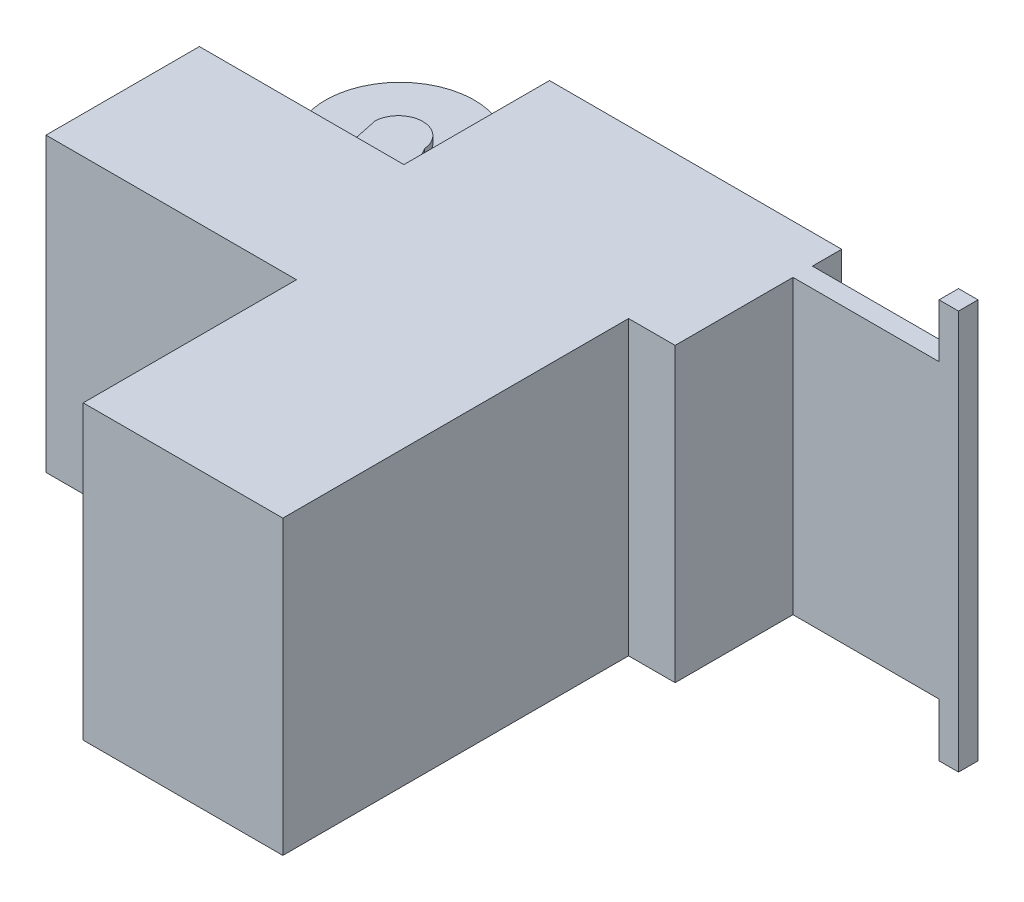
from build123d import *

# Parameters (mm, degrees)
SKETCH_1_W                     = 300
SKETCH_1_H                     = 171
EXTRUDE_1_DEPTH                = 300
SKETCH_2_W                     = 205.00000064
SKETCH_2_H                     = 300
EXTRUDE_2_DEPTH                = 355
SKETCH_3_W                     = 300
SKETCH_3_H                     = 136
EXTRUDE_3_DEPTH                = 257.21007636
EXTRUDE_4_DEPTH                = 24
EXTRUDE_5_DEPTH                = 120
EXTRUDE_7_DEPTH                = 62
CUT_EXTRUDE_3_DEPTH            = 133
EXTRUDE_9_DEPTH                = 62
CUT_EXTRUDE_4_DEPTH            = 7.5
CUT_EXTRUDE_START              = -7.5
CUT_EXTRUDE_5_DEPTH            = 7.5
SKETCH_13_W                    = 300
SKETCH_13_H                    = 20
EXTRUDE_10_DEPTH               = 170
SKETCH_14_W                    = 20
SKETCH_14_H                    = 20
EXTRUDE_11_DEPTH               = 55
SKETCH_15_W                    = 20
SKETCH_15_H                    = 20
EXTRUDE_13_DEPTH               = 55
MOVE_BODY_2_ANGLE              = 90
SPLIT_START                    = -187.136600778
SPLIT_BODIES_1_DEPTH           = 300
SPLIT_START_2                  = -242.136600778
SPLIT_BODIES_1_2_OUTLINE_W     = 20
SPLIT_BODIES_1_2_OUTLINE_H     = 20
SPLIT_BODIES_1_2_DEPTH         = 410
SPLIT_START_3                  = -212.722279175
SPLIT_BODIES_1_3_DEPTH         = 171
SPLIT_START_4                  = -68.136600778
SPLIT_BODIES_1_4_DEPTH         = 62
SPLIT_START_5                  = -97.136600778
SPLIT_BODIES_1_5_OUTLINE_W     = 120
SPLIT_BODIES_1_5_OUTLINE_H     = 24
SPLIT_BODIES_1_5_DEPTH         = 120
SKETCH_16_W                    = 210
SKETCH_16_H                    = 300
EXTRUDE_14_DEPTH               = 21.5
SPLIT_START_6                  = -63.222279175
SPLIT_BODIES_4_OUTLINE_W       = 257.21007636
SPLIT_BODIES_4_OUTLINE_H       = 300
SPLIT_BODIES_4_DEPTH           = 157.5
SPLIT_BODIES_4_2_OUTLINE_W     = 47.21007636
SPLIT_BODIES_4_2_OUTLINE_H     = 300
SPLIT_BODIES_4_2_DEPTH         = 149.5
SPLIT_BODIES_4_3_OUTLINE_W     = 257.21007636
SPLIT_BODIES_4_3_OUTLINE_H     = 300
SPLIT_BODIES_4_3_DEPTH         = 157.5
SPLIT_BODIES_4_4_OUTLINE_W     = 47.21007636
SPLIT_BODIES_4_4_OUTLINE_H     = 300
SPLIT_BODIES_4_4_DEPTH         = 149.5
SPLIT_BODIES_7_SURFACE_1_BACK  = 1003.933
SPLIT_BODIES_7_SURFACE_1_DEPTH = 2007.866
SPLIT_BODIES_7_SURFACE_2_BACK  = 1003.933
SPLIT_BODIES_7_SURFACE_2_DEPTH = 2007.866


# Read off the part's stored shape, not the designer's step: 部品分割1, 部品分割3, 部品分割4
with BuildPart() as part:
    # ｽｹｯﾁ1 → ﾎﾞｽ - 押し出し1 (new body)
    with BuildSketch(Plane(origin=(0, 0, 0), x_dir=(0, 0, -1), z_dir=(1, 0, 0))):
        with Locations((105.647745135, 53.288865182)):
            Rectangle(SKETCH_1_W, SKETCH_1_H)
    extrude(amount=EXTRUDE_1_DEPTH)

    # ｽｹｯﾁ2 → ﾎﾞｽ - 押し出し2 (add)
    with BuildSketch(Plane(origin=(0, 138.788865182, 0), x_dir=(1, 0, 0), z_dir=(0, 1, 0))):
        with Locations((149.71007668, 105.647745135)):
            Rectangle(SKETCH_2_W, SKETCH_2_H)
    extrude(amount=EXTRUDE_2_DEPTH)

    # ｽｹｯﾁ3 → ﾎﾞｽ - 押し出し3 (add)
    with BuildSketch(Plane.ZY.offset(-47.21007636)):
        with Locations((-105.647745135, 206.788865182)):
            Rectangle(SKETCH_3_W, SKETCH_3_H)
    extrude(amount=EXTRUDE_3_DEPTH)

    # ｽｹｯﾁ4 → ﾎﾞｽ - 押し出し4 (add)
    with BuildSketch(Plane.XZ.offset(-138.788865182)):
        Polygon((-141.96039145, -105.647745135), (-141.96039145, -45.647745135), (-21.96039145, -45.647745135), (-21.96039145, -165.647745135), (-141.96039145, -165.647745135), align=None)
    extrude(amount=EXTRUDE_4_DEPTH)

    # ｽｹｯﾁ5 → ﾎﾞｽ - 押し出し5 (add)
    with BuildSketch(Plane.XZ.offset(-114.788865182)):
        Polygon((-141.96039145, -105.647745135), (-141.96039145, -136.647745135), (-21.96039145, -136.647745135), (-21.96039145, -74.647745135), (-141.96039145, -74.647745135), align=None)
    extrude(amount=EXTRUDE_5_DEPTH)

    # ｽｹｯﾁ6 → ﾎﾞｽ - 押し出し7 (add)
    with BuildSketch(Plane(origin=(0, 0, -136.647745135), x_dir=(-1, 0, 0), z_dir=(0, 0, -1))):
        Polygon((141.96039145, 114.788865182), (81.96039145, 114.788865182), (122.64268945, -4.366639057), (147.64268945, -4.366639057), (147.64268945, 114.788865182), align=None)
        with BuildLine():
            Line((147.64268945, -4.366639057), (122.64268945, -4.366639057))
            ThreePointArc((122.64268945, -4.366639057), (147.64268945, -28.265469922), (172.64268945, -4.366639057))
            Line((172.64268945, -4.366639057), (147.64268945, -4.366639057))
        make_face()
        Polygon((172.64268945, -4.366639057), (147.64268945, 114.788865182), (147.64268945, -4.366639057), align=None)
    extrude(amount=-EXTRUDE_7_DEPTH)

    # ｽｹｯﾁ8 → ｶｯﾄ - 押し出し3 (cut)
    with BuildSketch(Plane(origin=(0, 0, -136.647745135), x_dir=(-1, 0, 0), z_dir=(0, 0, -1))):
        Polygon((122.695062033, -5.211134818), (55.539135991, 114.788865182), (21.96039145, 114.788865182), (21.96039145, -5.211134818), align=None)
    extrude(amount=-CUT_EXTRUDE_3_DEPTH, mode=Mode.SUBTRACT)

    # ｽｹｯﾁ13 → ﾎﾞｽ - 押し出し10 (add)
    with BuildSketch(Plane(origin=(300, 0, 0), x_dir=(0, 0, -1), z_dir=(1, 0, 0))):
        with Locations((105.647745135, 7.788865182)):
            Rectangle(SKETCH_13_W, SKETCH_13_H)
    extrude(amount=EXTRUDE_10_DEPTH)

    # ｽｹｯﾁ14 → ﾎﾞｽ - 押し出し11 (add)
    with BuildSketch(Plane.XY.offset(44.352254865)):
        with Locations((460, 7.788865182)):
            Rectangle(SKETCH_14_W, SKETCH_14_H)
    extrude(amount=EXTRUDE_11_DEPTH)

    # ｽｹｯﾁ15 → ﾎﾞｽ - 押し出し13 (add)
    with BuildSketch(Plane(origin=(0, 0, -255.647745135), x_dir=(-1, 0, 0), z_dir=(0, 0, -1))):
        with Locations((-460, 7.788865182)):
            Rectangle(SKETCH_15_W, SKETCH_15_H)
    extrude(amount=EXTRUDE_13_DEPTH)


with BuildPart() as body_2:
    # ｽｹｯﾁ9 → ﾎﾞｽ - 押し出し9 (new body)
    with BuildSketch(Plane(origin=(0, 0, -136.647745135), x_dir=(-1, 0, 0), z_dir=(0, 0, -1))):
        with BuildLine():
            ThreePointArc((172.64268945, -4.366639057), (148.065748541, -28.261893715), (122.695062033, -5.211134818))
            Line((122.695062033, -5.211134818), (92.689876472, 48.40471831))
            ThreePointArc((92.689876472, 48.40471831), (118.977792145, -75.704835229), (224.168875741, -4.788886938))
            ThreePointArc((224.168875741, -4.788886938), (204.898385478, 45.975600801), (156.795458346, 71.164753462))
            Line((156.795458346, 71.164753462), (172.64268945, -4.366639057))
        make_face()
    extrude(amount=-EXTRUDE_9_DEPTH)

    # ｽｹｯﾁ11 → ｶｯﾄ - 押し出し4 (cut)
    with BuildSketch(Plane(origin=(0, 0, -136.647745135), x_dir=(-1, 0, 0), z_dir=(0, 0, -1))):
        with BuildLine():
            Line((156.795458346, 71.164753462), (172.64268945, -4.366639057))
            ThreePointArc((172.64268945, -4.366639057), (148.065748541, -28.261893715), (122.695062033, -5.211134818))
            Line((122.695062033, -5.211134818), (92.689876472, 48.40471831))
            ThreePointArc((92.689876472, 48.40471831), (173.264106323, -76.880038763), (156.795458346, 71.164753462))
        make_face()
    extrude(amount=-CUT_EXTRUDE_4_DEPTH, mode=Mode.SUBTRACT)

    # ｽｹｯﾁ12 → ｶｯﾄ - 押し出し5 (cut)
    with BuildSketch(Plane.XY.offset(-74.647745135).offset(CUT_EXTRUDE_START)):
        with BuildLine():
            Line((-156.795458346, 71.164753462), (-172.64268945, -4.366639057))
            ThreePointArc((-172.64268945, -4.366639057), (-148.065748541, -28.261893715), (-122.695062033, -5.211134818))
            Line((-122.695062033, -5.211134818), (-92.689876472, 48.40471831))
            ThreePointArc((-92.689876472, 48.40471831), (-173.264106323, -76.880038763), (-156.795458346, 71.164753462))
        make_face()
    extrude(amount=CUT_EXTRUDE_5_DEPTH, mode=Mode.SUBTRACT)


with BuildPart() as part_1:
    # Move Body 2: moved
    add(part.part.rotate(Axis((0, 112.863399222, -105.647745135), (1, 0, 0)), MOVE_BODY_2_ANGLE))


with BuildPart() as body_2_1:
    # Move Body 2: moved
    add(body_2.part.rotate(Axis((0, 112.863399222, -105.647745135), (1, 0, 0)), MOVE_BODY_2_ANGLE))


with BuildPart() as part_2:
    # Move Body 3: moved
    add(part_1.part.moved(Location((-212, -150, 38))))

    # Split Bodies 1 3 outline → Split Bodies 1 3 (cut)
    with BuildSketch(Plane.XY.offset(SPLIT_START_3)):
        Polygon((-212, 112.863399222), (-212, -187.136600778), (238, -187.136600778), (238, -242.136600778), (258, -242.136600778), (258, 167.863399222), (238, 167.863399222), (238, 112.863399222), align=None)
        Polygon((-386, -6.136600778), (-386, -68.136600778), (-353.96039145, -68.136600778), (-353.96039145, -97.136600778), (-233.96039145, -97.136600778), (-233.96039145, 22.863399222), (-353.96039145, 22.863399222), (-353.96039145, -6.136600778), align=None)
    extrude(amount=SPLIT_BODIES_1_3_DEPTH, mode=Mode.SUBTRACT)


with BuildPart() as body_2_2:
    # Move Body 3: moved
    add(body_2_1.part.moved(Location((-212, -150, 38))))


with BuildPart() as body_3:
    # Split Bodies 1 outline → Split Bodies 1 (new body)
    with BuildSketch(Plane(origin=(0, 0, 0), x_dir=(1, 0, 0), z_dir=(0, 1.0, 1.1906985813992e-12)).offset(SPLIT_START)):
        Polygon((-212, 41.722279175), (88, 41.722279175), (88, 162.722279175), (258, 162.722279175), (258, 182.722279175), (88, 182.722279175), (88, 212.722279175), (-212, 212.722279175), align=None)
    extrude(amount=SPLIT_BODIES_1_DEPTH)

    # Split Bodies 1 2 outline → Split Bodies 1 2 (add)
    with BuildSketch(Plane(origin=(0, 0, 0), x_dir=(1, 0, 0), z_dir=(0, 1.0, 1.1906985813992e-12)).offset(SPLIT_START_2)):
        with Locations((248, 172.722279175)):
            Rectangle(SPLIT_BODIES_1_2_OUTLINE_W, SPLIT_BODIES_1_2_OUTLINE_H)
    extrude(amount=SPLIT_BODIES_1_2_DEPTH)


with BuildPart() as body_4:
    # Split Bodies 1 4 outline → Split Bodies 1 4 (new body)
    with BuildSketch(Plane(origin=(0, 0, 0), x_dir=(1, 0, 0), z_dir=(0, 1.0, 1.1906985813992e-12)).offset(SPLIT_START_4)):
        with BuildLine():
            Line((-233.96039145, 41.722279175), (-233.96039145, 65.722279175))
            Line((-233.96039145, 65.722279175), (-267.539135991, 65.722279175))
            Line((-267.539135991, 65.722279175), (-334.695062033, 185.722279175))
            ThreePointArc((-334.695062033, 185.722279175), (-360.065748541, 208.773038071), (-384.64268945, 184.877783414))
            Line((-384.64268945, 184.877783414), (-359.64268945, 65.722279175))
            Line((-359.64268945, 65.722279175), (-353.96039145, 65.722279175))
            Line((-353.96039145, 65.722279175), (-353.96039145, 41.722279175))
            Line((-353.96039145, 41.722279175), (-233.96039145, 41.722279175))
        make_face()
    extrude(amount=SPLIT_BODIES_1_4_DEPTH)

    # Split Bodies 1 5 outline → Split Bodies 1 5 (add)
    with BuildSketch(Plane(origin=(0, 0, 0), x_dir=(1, 0, 0), z_dir=(0, 1.0, 1.1906985813992e-12)).offset(SPLIT_START_5)):
        with Locations((-293.96039145, 53.722279175)):
            Rectangle(SPLIT_BODIES_1_5_OUTLINE_W, SPLIT_BODIES_1_5_OUTLINE_H)
    extrude(amount=SPLIT_BODIES_1_5_DEPTH)


with BuildPart() as body_4_1:
    # Move Body 4: moved
    add(body_4.part.moved(Location((0, 0, -21.5))))


with BuildPart() as body_2_3:
    # Move Body 4: moved
    add(body_2_2.part.moved(Location((0, 0, -21.5))))


with BuildPart() as body_5:
    # ｽｹｯﾁ16 → ﾎﾞｽ - 押し出し14 (new body)
    with BuildSketch(Plane(origin=(0, 0, -41.722279175), x_dir=(-1, 0, 0), z_dir=(0, 1.1906985813991966e-12, -1.0))):
        with Locations((317, -37.136600778)):
            Rectangle(SKETCH_16_W, SKETCH_16_H)
    extrude(amount=EXTRUDE_14_DEPTH)


with BuildPart() as part_3:
    add(part_2.part)

    # Combine 1: union body 5, body 3, body 4, body 2
    add(body_5.part)
    add(body_3.part)
    add(body_4_1.part)
    add(body_2_3.part)


with BuildPart() as body_2_2_1:
    # Split Bodies 3: the piece on the far side of the plane
    add(part_3.part)
    split(bisect_by=Plane.YZ.offset(-164.78992364), keep=Keep.BOTTOM)

    # Split Bodies 4 outline → Split Bodies 4 (cut)
    with BuildSketch(Plane.XY.offset(SPLIT_START_6)):
        with Locations((-293.39496182, -37.136600778)):
            Rectangle(SPLIT_BODIES_4_OUTLINE_W, SPLIT_BODIES_4_OUTLINE_H)
    extrude(amount=SPLIT_BODIES_4_DEPTH, mode=Mode.SUBTRACT)

    # Split Bodies 4 2 outline → Split Bodies 4 2 (cut)
    with BuildSketch(Plane.XY.offset(SPLIT_START_3)):
        with Locations((-188.39496182, -37.136600778)):
            Rectangle(SPLIT_BODIES_4_2_OUTLINE_W, SPLIT_BODIES_4_2_OUTLINE_H)
    extrude(amount=SPLIT_BODIES_4_2_DEPTH, mode=Mode.SUBTRACT)


with BuildPart() as part_4:
    add(part_3.part)

    # Split Bodies 3
    split(bisect_by=Plane.YZ.offset(-164.78992364), keep=Keep.TOP)


with BuildPart() as body_3_2:
    # Split Bodies 4 3 outline → Split Bodies 4 3 (new body)
    with BuildSketch(Plane.XY.offset(SPLIT_START_6)):
        with Locations((-293.39496182, -37.136600778)):
            Rectangle(SPLIT_BODIES_4_3_OUTLINE_W, SPLIT_BODIES_4_3_OUTLINE_H)
    extrude(amount=SPLIT_BODIES_4_3_DEPTH)

    # Split Bodies 4 4 outline → Split Bodies 4 4 (add)
    with BuildSketch(Plane.XY.offset(SPLIT_START_3)):
        with Locations((-188.39496182, -37.136600778)):
            Rectangle(SPLIT_BODIES_4_4_OUTLINE_W, SPLIT_BODIES_4_4_OUTLINE_H)
    extrude(amount=SPLIT_BODIES_4_4_DEPTH)


with BuildPart() as body_4_2:
    # Split Bodies 7: the piece behind the surface
    add(part_4.part)
    # Split Bodies 7 surface: a surface, the sketch's curves swept straight by 2007.866 mm
    with BuildLine(Plane.XY.offset(313.277720825).offset(-SPLIT_BODIES_7_SURFACE_1_BACK), mode=Mode.PRIVATE) as split_bodies_7_surface_1_path:
        Line((-60.73235277, -188.487666989), (-60.73235277, 112.863399222))
    split_bodies_7_surface_1 = Shell.extrude(split_bodies_7_surface_1_path.wire(), (0 * SPLIT_BODIES_7_SURFACE_1_DEPTH, 0 * SPLIT_BODIES_7_SURFACE_1_DEPTH, 1 * SPLIT_BODIES_7_SURFACE_1_DEPTH))
    split(bisect_by=split_bodies_7_surface_1, keep=Keep.BOTTOM)


with BuildPart() as part_5:
    add(part_4.part)

    # Split Bodies 7: split by a surface, the side it looks to stays
    # Split Bodies 7 surface: a surface, the sketch's curves swept straight by 2007.866 mm
    with BuildLine(Plane.XY.offset(313.277720825).offset(-SPLIT_BODIES_7_SURFACE_2_BACK), mode=Mode.PRIVATE) as split_bodies_7_surface_2_path:
        Line((-60.73235277, -188.487666989), (-60.73235277, 112.863399222))
    split_bodies_7_surface_2 = Shell.extrude(split_bodies_7_surface_2_path.wire(), (0 * SPLIT_BODIES_7_SURFACE_2_DEPTH, 0 * SPLIT_BODIES_7_SURFACE_2_DEPTH, 1 * SPLIT_BODIES_7_SURFACE_2_DEPTH))
    split(bisect_by=split_bodies_7_surface_2, keep=Keep.TOP)


with BuildPart() as body_3_2_1:
    add(body_3_2.part)

    # Combine 2: union body 2 2, part, body 4 2
    add(body_2_2_1.part)
    add(part_5.part)
    add(body_4_2.part)


solid = body_3_2_1.part
